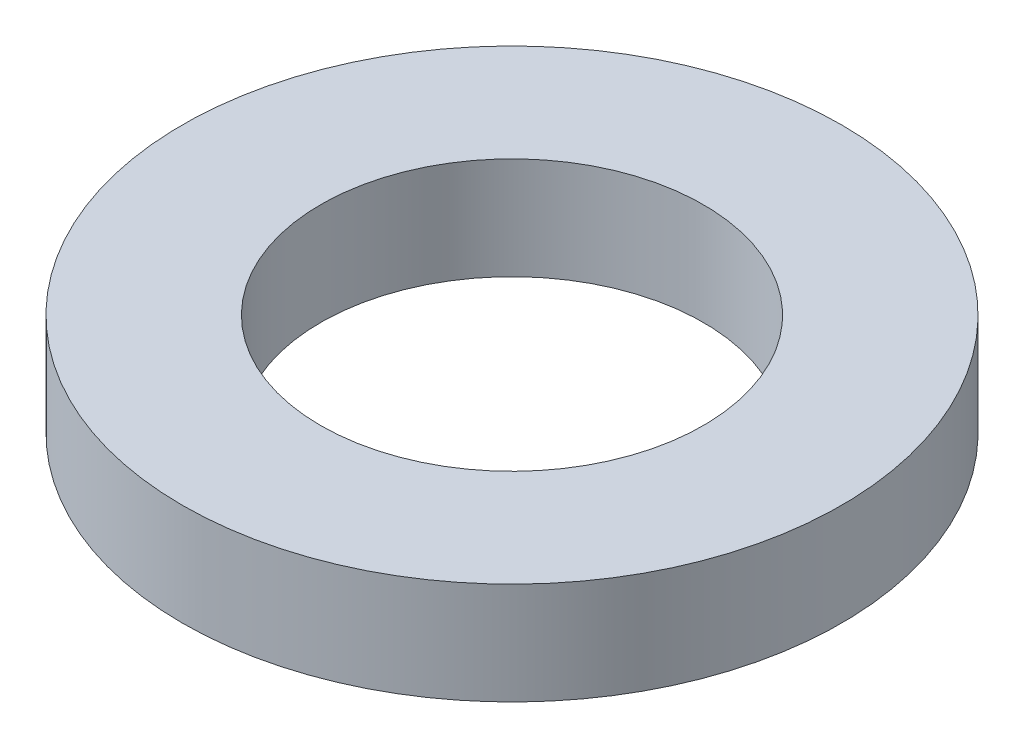
from build123d import *

# Parameters (mm, degrees)
SKETCH1_R           = 77.5
BOSS_EXTRUDE1_DEPTH = 24
SKETCH2_R           = 45
CUT_EXTRUDE1_DEPTH  = 113.198484838


with BuildPart() as part:
    # Sketch1 → Boss-Extrude1 (new body)
    with BuildSketch(Plane(origin=(0, 0, 0), x_dir=(1, 0, 0), z_dir=(0, 1, 0))):
        Circle(SKETCH1_R)
    extrude(amount=BOSS_EXTRUDE1_DEPTH)

    # Sketch2 → Cut-Extrude1 (cut, through all)
    with BuildSketch(Plane(origin=(0, 0, 0), x_dir=(1, 0, 0), z_dir=(0, 1, 0))):
        Circle(SKETCH2_R)
    extrude(amount=CUT_EXTRUDE1_DEPTH, mode=Mode.SUBTRACT)


solid = part.part
